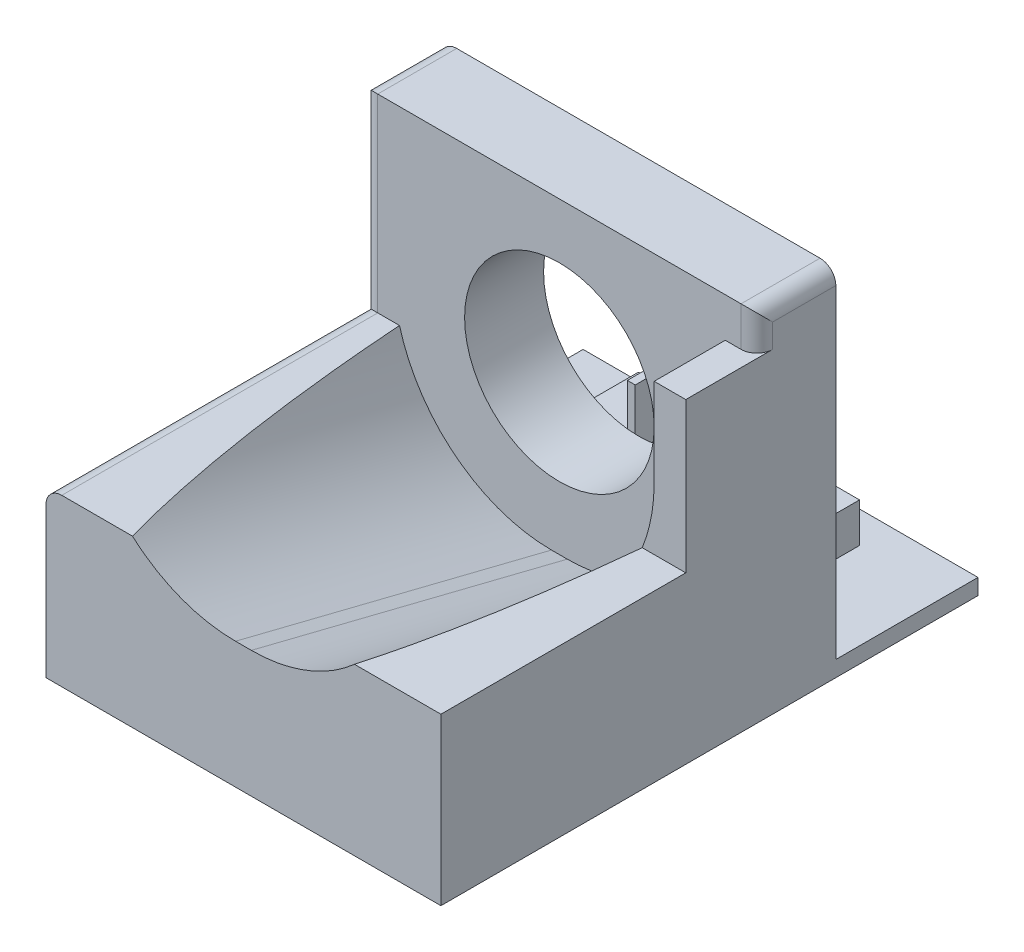
from build123d import *

# Parameters (mm, degrees)
SKETCH2_W                = 250
SKETCH2_H                = 250
BOSS_EXTRUDE1_DEPTH      = 250
SKETCH3_W                = 210
SKETCH3_H                = 200
CUT_EXTRUDE1_DEPTH       = 220
BOSS_EXTRUDE2_REACH      = 363.974
FILLET1_R                = 100
FILLET2_R                = 20
SKETCH11_R               = 60
CUT_EXTRUDE2_DEPTH       = 344.693177122
SKETCH12_W               = 250
SKETCH12_H               = 10
BOSS_EXTRUDE3_DEPTH      = 90
BOSS_EXTRUDE4_START      = 20
SKETCH13_W               = 5
SKETCH13_H               = 20
BOSS_EXTRUDE4_DEPTH      = 50
BOSS_EXTRUDE5_START      = 20
SKETCH14_W               = 5
SKETCH14_H               = 42
BOSS_EXTRUDE5_DEPTH      = 50
SKETCH15_W               = 20
SKETCH15_H               = 40
CUT_EXTRUDE3_DEPTH       = 20
SKETCH17_W               = 20
SKETCH17_H               = 40
CUT_EXTRUDE5_DEPTH       = 23
SKETCH18_W               = 20
SKETCH18_H               = 10
BOSS_EXTRUDE6_DEPTH      = 20
SKETCH19_W               = 250
SKETCH19_H               = 50
CUT_EXTRUDE11_DEPTH      = 70
SKETCH24_W               = 200
SKETCH24_H               = 95
CUT_EXTRUDE12_DEPTH      = 70
CUT_EXTRUDE14_DEPTH      = 414.793426724
SKETCH26_W               = 75
SKETCH26_H               = 50
CUT_EXTRUDE15_DEPTH      = 344.693177122
BOSS_EXTRUDE7_REACH      = 415.793
SKETCH27_W               = 50
SKETCH27_H               = 25
CUT_EXTRUDE16_DEPTH      = 374.296129099
CUT_EXTRUDE16_DEPTH_BACK = 374.296129099
SKETCH28_W               = 50
SKETCH28_H               = 25
FILLET3_R                = 10
SKETCH29_W               = 20
SKETCH29_H               = 39.615
BOSS_EXTRUDE8_DEPTH      = 95


with BuildPart() as part:
    # Sketch2 → Boss-Extrude1 (new body)
    with BuildSketch(Plane(origin=(0, 0, 0), x_dir=(1, 0, 0), z_dir=(0, 1, 0))):
        Rectangle(SKETCH2_W, SKETCH2_H)
    extrude(amount=BOSS_EXTRUDE1_DEPTH)

    # Sketch3 → Cut-Extrude1 (cut)
    with BuildSketch(Plane(origin=(0, 250, 0), x_dir=(1, 0, 0), z_dir=(0, 1, 0))):
        with Locations((0, -25)):
            Rectangle(SKETCH3_W, SKETCH3_H)
    extrude(amount=-CUT_EXTRUDE1_DEPTH, mode=Mode.SUBTRACT)

    # Sketch5 → Boss-Extrude2 (add, up to next)
    with BuildSketch(Plane.ZY.offset(-105), mode=Mode.PRIVATE) as boss_extrude2_sk1:
        Polygon((125, 30), (125, 80), (-75, 30), align=None)
    boss_extrude2_tool1 = extrude(boss_extrude2_sk1.sketch, amount=BOSS_EXTRUDE2_REACH, mode=Mode.PRIVATE) - part.part
    add(boss_extrude2_tool1.solids().sort_by_distance((105, 46.666667, 58.333333))[0])

    # Fillet1
    fillet1_edges = [part.edges().sort_by_distance(p)[0] for p in [
        (-105, 55, 25),
        (105, 55, 25),
    ]]
    fillet(fillet1_edges, radius=FILLET1_R)

    # Fillet2
    fillet2_edges = [part.edges().sort_by_distance(p)[0] for p in [
        (115, 250, 125),
        (-115, 250, 125),
        (105, 250, 25),
        (0, 250, -75),
        (-105, 250, 25),
    ]]
    fillet(fillet2_edges, radius=FILLET2_R - 0.0001)  # a hair under: the kernel refuses the full size

    # Sketch11 → Cut-Extrude2 (cut, through all)
    with BuildSketch(Plane.XY.offset(-75)):
        with Locations((0, 130)):
            Circle(SKETCH11_R)
    extrude(amount=-CUT_EXTRUDE2_DEPTH, mode=Mode.SUBTRACT)

    # Sketch12 → Boss-Extrude3 (add)
    with BuildSketch(Plane(origin=(0, 0, -125), x_dir=(-1, 0, 0), z_dir=(0, 0, -1))):
        with Locations((0, 5)):
            Rectangle(SKETCH12_W, SKETCH12_H)
    extrude(amount=BOSS_EXTRUDE3_DEPTH)

    # Sketch13 → Boss-Extrude4 (add)
    with BuildSketch(Plane(origin=(0, 0, -125), x_dir=(-1, 0, 0), z_dir=(0, 0, -1)).offset(BOSS_EXTRUDE4_START)):
        Polygon((-70, 35), (-70, 30), (-65, 30), (0, 30), (0, 35), align=None)
        Polygon((0, 35), (0, 30), (65, 30), (70, 30), (70, 35), align=None)
        with Locations((67.5, 20)):
            Rectangle(SKETCH13_W, SKETCH13_H)
        with Locations((-67.5, 20)):
            Rectangle(SKETCH13_W, SKETCH13_H)
    extrude(amount=BOSS_EXTRUDE4_DEPTH)

    # Sketch14 → Boss-Extrude5 (add)
    with BuildSketch(Plane(origin=(0, 0, -125), x_dir=(-1, 0, 0), z_dir=(0, 0, -1)).offset(BOSS_EXTRUDE5_START)):
        with Locations((24.5, 56)):
            Rectangle(SKETCH14_W, SKETCH14_H)
        with Locations((-24.5, 56)):
            Rectangle(SKETCH14_W, SKETCH14_H)
    extrude(amount=BOSS_EXTRUDE5_DEPTH)

    # Sketch15 → Cut-Extrude3 (cut)
    with BuildSketch(Plane(origin=(125, 0, 0), x_dir=(0, 0, -1), z_dir=(1, 0, 0))):
        with Locations((54.23, 147.66)):
            Rectangle(SKETCH15_W, SKETCH15_H)
    extrude(amount=-CUT_EXTRUDE3_DEPTH, mode=Mode.SUBTRACT)

    # Sketch17 → Cut-Extrude5 (cut)
    with BuildSketch(Plane(origin=(125, 0, 0), x_dir=(0, 0, -1), z_dir=(1, 0, 0))):
        with Locations((54.23, 142.66)):
            Rectangle(SKETCH17_W, SKETCH17_H)
    extrude(amount=-CUT_EXTRUDE5_DEPTH, mode=Mode.SUBTRACT)

    # Sketch18 → Boss-Extrude6 (add)
    with BuildSketch(Plane(origin=(125, 0, 0), x_dir=(0, 0, -1), z_dir=(1, 0, 0))):
        with Locations((54.23, 162.66)):
            Rectangle(SKETCH18_W, SKETCH18_H)
    extrude(amount=-BOSS_EXTRUDE6_DEPTH)

    # Sketch19 → Cut-Extrude11 (cut)
    with BuildSketch(Plane.ZY.offset(125)):
        with Locations((0, 225)):
            Rectangle(SKETCH19_W, SKETCH19_H)
    extrude(amount=-CUT_EXTRUDE11_DEPTH, mode=Mode.SUBTRACT)

    # Sketch24 → Cut-Extrude12 (cut)
    with BuildSketch(Plane.ZY.offset(125)):
        with Locations((25, 152.5)):
            Rectangle(SKETCH24_W, SKETCH24_H)
    extrude(amount=-CUT_EXTRUDE12_DEPTH, mode=Mode.SUBTRACT)

    # Sketch25 → Cut-Extrude14 (cut, through all)
    with BuildSketch(Plane.ZY.offset(125)):
        Polygon((125, 105), (-30, 105), (-30, 200), (-75, 200), (-75, 250), (125, 250), align=None)
    extrude(amount=-CUT_EXTRUDE14_DEPTH, mode=Mode.SUBTRACT)

    # Sketch26 → Cut-Extrude15 (cut, through all)
    with BuildSketch(Plane.XY.offset(-75)):
        with Locations((87.5, 225)):
            Rectangle(SKETCH26_W, SKETCH26_H)
    extrude(amount=-CUT_EXTRUDE15_DEPTH, mode=Mode.SUBTRACT)

    # Boss-Extrude7: up to this face of the body (flat: up to its plane)
    boss_extrude7_end = Plane(part.part.faces().sort_by_distance((-125, 66.05015674, -19.686520376))[0])
    # Sketch27 → Boss-Extrude7 (add, up to the picked face)
    with BuildSketch(Plane(origin=(125, 0, 0), x_dir=(0, 0, -1), z_dir=(1, 0, 0)), mode=Mode.PRIVATE) as boss_extrude7_sk1:
        with Locations((100, 212.5)):
            Rectangle(SKETCH27_W, SKETCH27_H)
    boss_extrude7_tool1 = split(extrude(boss_extrude7_sk1.sketch, amount=-BOSS_EXTRUDE7_REACH, mode=Mode.PRIVATE), bisect_by=boss_extrude7_end, keep=Keep.BOTH, mode=Mode.PRIVATE)
    add(boss_extrude7_tool1.solids().sort_by(Axis((125, 212.5, -100), (-1, 0, 0)))[0])

    # Sketch28 → Cut-Extrude16 (cut, two sides: drawn at the far end of the back side and taken through both)
    with BuildSketch(Plane(origin=(50, 0, 0), x_dir=(0, 0, -1), z_dir=(1, 0, 0)).offset(-CUT_EXTRUDE16_DEPTH_BACK)):
        with Locations((100, 237.5)):
            Rectangle(SKETCH28_W, SKETCH28_H)
    extrude(amount=CUT_EXTRUDE16_DEPTH + CUT_EXTRUDE16_DEPTH_BACK, mode=Mode.SUBTRACT)

    # Fillet3
    fillet3_edges = [part.edges().sort_by_distance(p)[0] for p in [
        (-125, 165, -75),
        (-125, 105, 25),
        (125, 225, -100),
        (125, 212.5, -75),
        (-125, 225, -100),
    ]]
    fillet(fillet3_edges, radius=FILLET3_R)

    # Sketch29 → Boss-Extrude8 (add)
    with BuildSketch(Plane(origin=(0, 200, 0), x_dir=(1, 0, 0), z_dir=(0, 1, 0))):
        with Locations((115, 49.8075)):
            Rectangle(SKETCH29_W, SKETCH29_H)
    extrude(amount=-BOSS_EXTRUDE8_DEPTH)


solid = part.part
